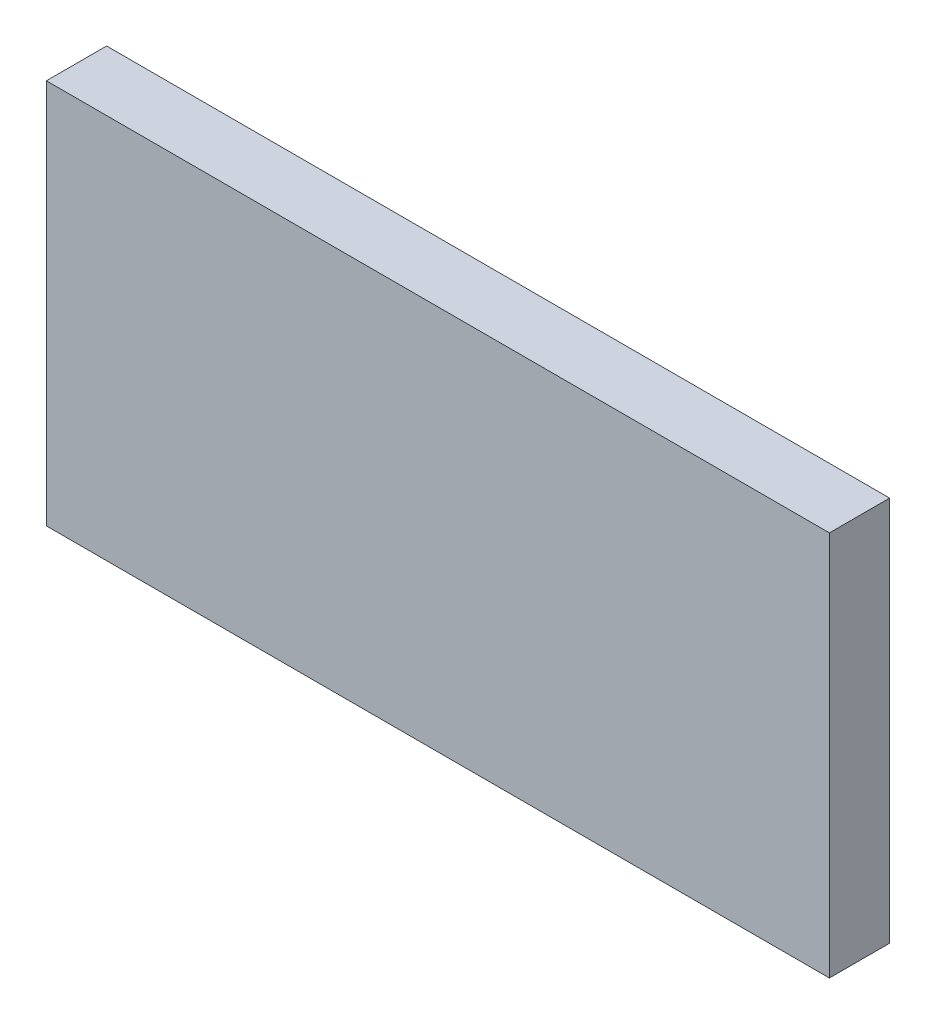
from build123d import *

# Parameters (mm, degrees)
SKETCH1_W            = 15
SKETCH1_H            = 20
BOSS_EXTRUDE1_DEPTH  = 230
SKETCH2_W            = 65
SKETCH2_H            = 32
BOSS_EXTRUDE6_DEPTH  = 5
SKETCH7_W            = 75
SKETCH7_H            = 15
BOSS_EXTRUDE7_DEPTH  = 5
SKETCH8_W            = 75
SKETCH8_H            = 19
BOSS_EXTRUDE8_DEPTH  = 5
SKETCH9_W            = 65
SKETCH9_H            = 32
BOSS_EXTRUDE11_DEPTH = 5
CUT_EXTRUDE1_DEPTH   = 239.094519047


with BuildPart() as part:
    # Sketch1 → Boss-Extrude1 (new body)
    with BuildSketch(Plane.XY):
        Rectangle(SKETCH1_W, SKETCH1_H)
    extrude(amount=BOSS_EXTRUDE1_DEPTH)

    # Sketch10 → Cut-Extrude1 (cut, through all)
    with BuildSketch(Plane.ZY.offset(7.5)):
        with BuildLine():
            Line((209.843145751, 2), (211.343145751, 2))
            ThreePointArc((211.343145751, 2), (223, 0), (211.343145751, -2))
            Line((211.343145751, -2), (209.843145751, -2))
            Line((209.843145751, -2), (209.843145751, 2))
        make_face()
    extrude(amount=-CUT_EXTRUDE1_DEPTH, mode=Mode.SUBTRACT)


with BuildPart() as body_2:
    # Sketch2 → Boss-Extrude6 (new body)
    with BuildSketch(Plane(origin=(0, 0, 0), x_dir=(-1, 0, 0), z_dir=(0, 0, -1))):
        with Locations((0, 26)):
            Rectangle(SKETCH2_W, SKETCH2_H)
    extrude(amount=-BOSS_EXTRUDE6_DEPTH)


with BuildPart() as body_3:
    # Sketch7 → Boss-Extrude7 (new body)
    with BuildSketch(Plane(origin=(32.5, 0, 0), x_dir=(0, 0, -1), z_dir=(1, 0, 0))):
        with Locations((-37.5, 26)):
            Rectangle(SKETCH7_W, SKETCH7_H)
    extrude(amount=BOSS_EXTRUDE7_DEPTH)


with BuildPart() as body_4:
    # Sketch8 → Boss-Extrude8 (new body)
    with BuildSketch(Plane.ZY.offset(32.5)):
        with Locations((37.5, 28)):
            Rectangle(SKETCH8_W, SKETCH8_H)
    extrude(amount=BOSS_EXTRUDE8_DEPTH)


with BuildPart() as body_5:
    # Sketch9 → Boss-Extrude11 (new body)
    with BuildSketch(Plane.XY.offset(75)):
        with Locations((0, 26)):
            Rectangle(SKETCH9_W, SKETCH9_H)
    extrude(amount=-BOSS_EXTRUDE11_DEPTH)


solid = body_2.part
